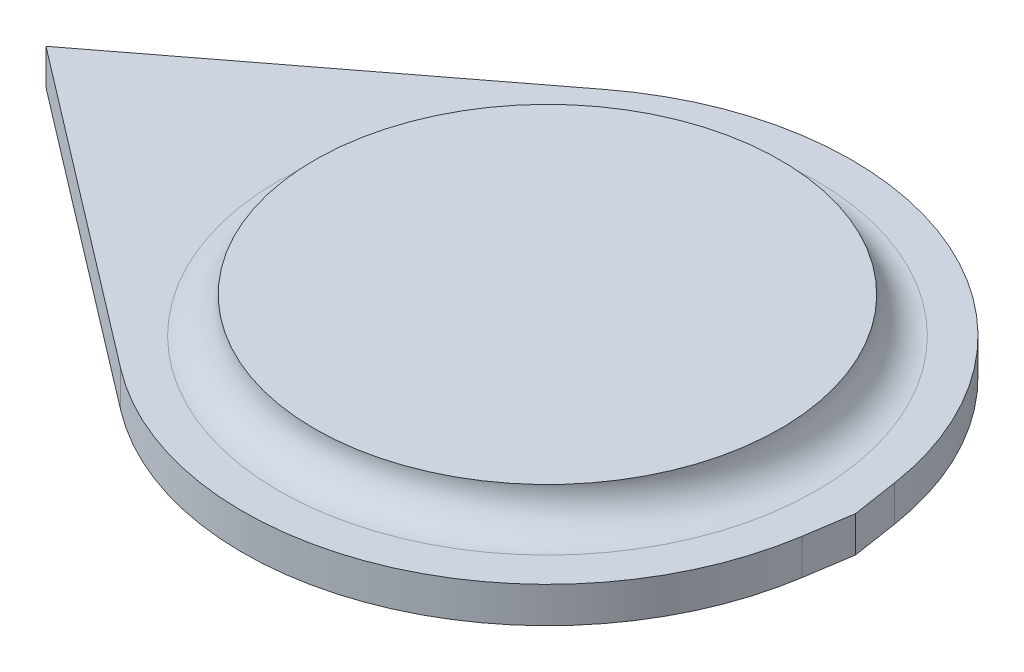
from build123d import *

# Parameters (mm, degrees)
BOSS_EXTRUDE1_DEPTH = 5
SKETCH2_R           = 32.5
BOSS_EXTRUDE2_DEPTH = 5
FILLET1_R           = 5


with BuildPart() as part:
    # Sketch1 → Boss-Extrude1 (new body)
    with BuildSketch(Plane(origin=(0, 0, 0), x_dir=(1, 0, 0), z_dir=(0, 1, 0))):
        with BuildLine():
            Line((-25.803571429, 33.770189539), (-70, 0))
            Line((-70, 0), (-25.803571429, -33.770189539))
            ThreePointArc((-25.803571429, -33.770189539), (15.876337275, -39.423240794), (42.005813953, -6.462321108))
            Line((42.005813953, -6.462321108), (43, 0))
            Line((43, 0), (42.005813953, 6.462321108))
            ThreePointArc((42.005813953, 6.462321108), (15.876337275, 39.423240794), (-25.803571429, 33.770189539))
        make_face()
    extrude(amount=BOSS_EXTRUDE1_DEPTH)

    # Sketch2 → Boss-Extrude2 (add)
    with BuildSketch(Plane(origin=(0, 5, 0), x_dir=(1, 0, 0), z_dir=(0, 1, 0))):
        with Locations(Location((0, 0, 0), (0, 0, 270))):
            Circle(SKETCH2_R)
    extrude(amount=BOSS_EXTRUDE2_DEPTH)

    # Fillet1
    fillet1_edges = [part.edges().sort_by_distance(p)[0] for p in [
        (0, 5, -32.5),
    ]]
    fillet(fillet1_edges, radius=FILLET1_R - 0.0001)  # a hair under: the kernel refuses the full size


solid = part.part
